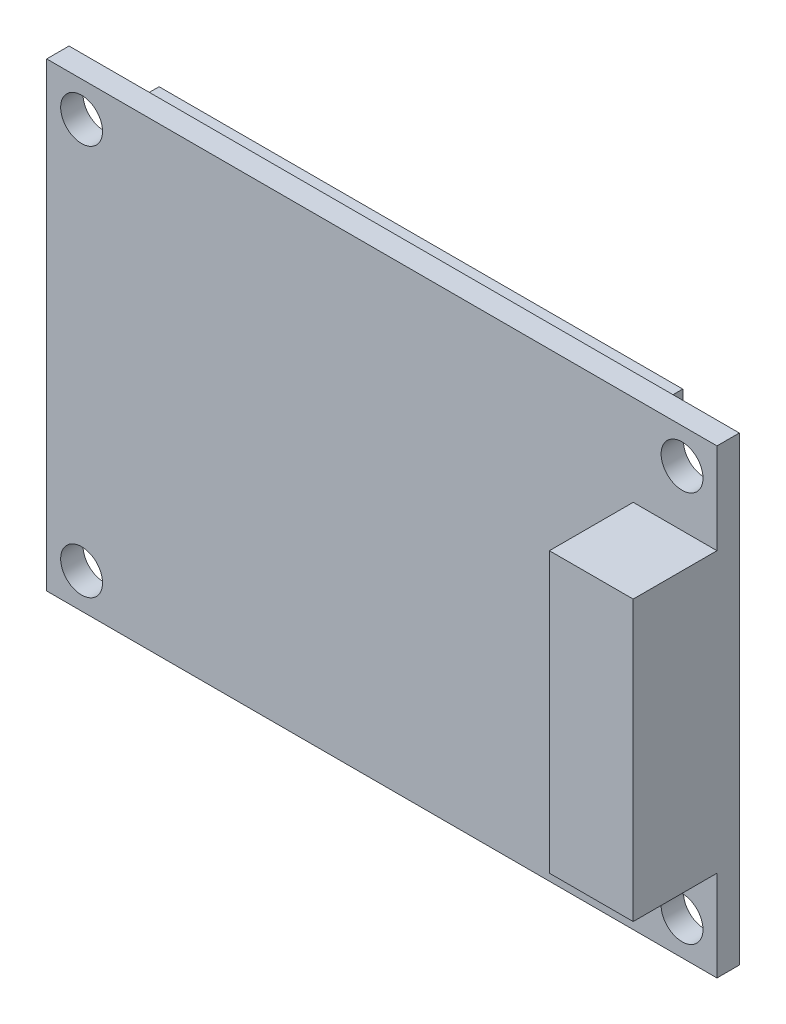
from build123d import *

# Parameters (mm, degrees)
BASE_PCB_2_W              = 48
BASE_PCB_2_H              = 33
BASE_PCB_2_R              = 1.5
BASE_PCB_DEPTH            = 1.6
ESQUISSE4_W               = 37.5
ESQUISSE4_H               = 32
E_INK_DISPLAY_DEPTH       = 1.2
ESQUISSE5_W               = 27.6
ESQUISSE5_H               = 27.6
DISPLAY_200_200_DEPTH     = 0.5
ESQUISSE6_W               = 6
ESQUISSE6_H               = 20
CONNECTEUR_8BROCHES_DEPTH = 6


with BuildPart() as part:
    # BASE PCB 2 → Base_PCB (new body)
    with BuildSketch(Plane.XY):
        Rectangle(BASE_PCB_2_W, BASE_PCB_2_H)
        with Locations((-21.5, 14)):
            Circle(BASE_PCB_2_R, mode=Mode.SUBTRACT)
        with Locations((-21.5, -14)):
            Circle(BASE_PCB_2_R, mode=Mode.SUBTRACT)
        with Locations((21.5, -14)):
            Circle(BASE_PCB_2_R, mode=Mode.SUBTRACT)
        with Locations((21.5, 14)):
            Circle(BASE_PCB_2_R, mode=Mode.SUBTRACT)
    extrude(amount=BASE_PCB_DEPTH)

    # Esquisse4 → E-Ink_display (add)
    with BuildSketch(Plane.XY):
        Rectangle(ESQUISSE4_W, ESQUISSE4_H)
    extrude(amount=-E_INK_DISPLAY_DEPTH)

    # Esquisse5 → Display_200*200 (cut)
    with BuildSketch(Plane(origin=(0, 0, -1.2), x_dir=(-1, 0, 0), z_dir=(0, 0, -1))):
        with Locations((-2.95, 0)):
            Rectangle(ESQUISSE5_W, ESQUISSE5_H)
    extrude(amount=-DISPLAY_200_200_DEPTH, mode=Mode.SUBTRACT)

    # Esquisse6 → Connecteur_8broches (add)
    with BuildSketch(Plane.XY.offset(1.6)):
        with Locations((21, 0)):
            Rectangle(ESQUISSE6_W, ESQUISSE6_H)
    extrude(amount=CONNECTEUR_8BROCHES_DEPTH)


solid = part.part
